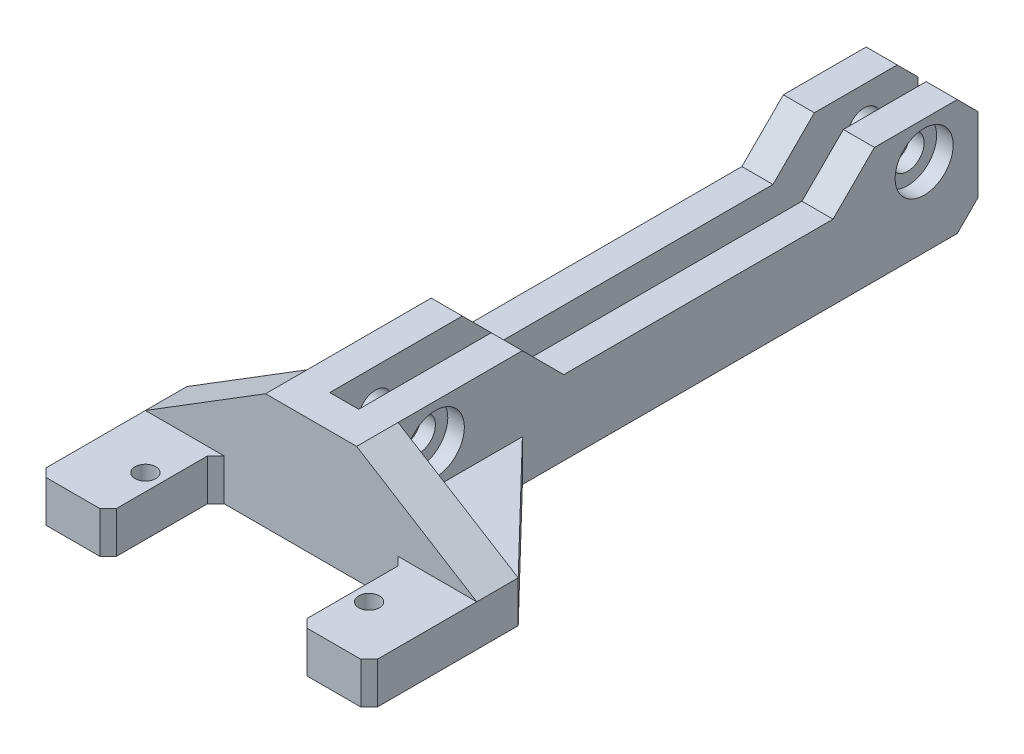
from build123d import *

# Parameters (mm, degrees)
SKETCH1_W           = 11
SKETCH1_H           = 70
SKETCH1_W_2         = 40
SKETCH1_H_2         = 18
BOSS_EXTRUDE1_DEPTH = 5
SKETCH3_W           = 23
SKETCH3_H           = 13
CUT_EXTRUDE2_DEPTH  = 57.868268832
SKETCH4_R           = 1.25
CUT_EXTRUDE3_DEPTH  = 57.868268832
SKETCH5_W           = 11
SKETCH5_H           = 75
BOSS_EXTRUDE2_DEPTH = 9
SKETCH6_W           = 3.5
SKETCH6_H           = 70
CUT_EXTRUDE4_DEPTH  = 59.352377844
SKETCH7_R           = 2
CUT_EXTRUDE5_DEPTH  = 61.458663564
RIB2_REACH          = 80.873
SKETCH8_WALL_W      = 176.81268046
SKETCH8_WALL_H      = 5
RIB4_REACH          = 80.873
SKETCH9_WALL_W      = 176.81268046
SKETCH9_WALL_H      = 5
RIB8_REACH          = 60.352
SKETCH10_WALL_W     = 139.567401732
SKETCH10_WALL_H     = 5
SKETCH14_W          = 42.5
SKETCH14_H          = 5
CUT_EXTRUDE6_DEPTH  = 61.458663564
CHAMFER9_SIZE       = 5
CHAMFER10_SIZE      = 2.5
CHAMFER11_SIZE      = 1
CHAMFER12_SIZE      = 1
SKETCH15_R          = 3.5
CUT_EXTRUDE7_DEPTH  = 2
CHAMFER14_SIZE      = 1


with BuildPart() as part:
    # Sketch1 → Boss-Extrude1 (new body)
    with BuildSketch(Plane(origin=(0, 0, 0), x_dir=(1, 0, 0), z_dir=(0, 1, 0))):
        Rectangle(SKETCH1_W, SKETCH1_H)
        with Locations((0, -44)):
            Rectangle(SKETCH1_W_2, SKETCH1_H_2)
    extrude(amount=BOSS_EXTRUDE1_DEPTH)

    # Sketch3 → Cut-Extrude2 (cut, through all)
    with BuildSketch(Plane(origin=(0, 5, 0), x_dir=(1, 0, 0), z_dir=(0, 1, 0))):
        with Locations((0, -46.5)):
            Rectangle(SKETCH3_W, SKETCH3_H)
    extrude(amount=-CUT_EXTRUDE2_DEPTH, mode=Mode.SUBTRACT)

    # Sketch4 → Cut-Extrude3 (cut, through all)
    with BuildSketch(Plane(origin=(0, 5, 0), x_dir=(1, 0, 0), z_dir=(0, 1, 0))):
        with Locations(Location((-13.5, -46.5, 0), (0, 0, 270))):
            Circle(SKETCH4_R)
        with Locations(Location((13.5, -46.5, 0), (0, 0, 270))):
            Circle(SKETCH4_R)
    extrude(amount=-CUT_EXTRUDE3_DEPTH, mode=Mode.SUBTRACT)

    # Sketch5 → Boss-Extrude2 (add)
    with BuildSketch(Plane(origin=(0, 5, 0), x_dir=(1, 0, 0), z_dir=(0, 1, 0))):
        with Locations((0, -2.5)):
            Rectangle(SKETCH5_W, SKETCH5_H)
    extrude(amount=BOSS_EXTRUDE2_DEPTH)

    # Sketch6 → Cut-Extrude4 (cut, through all)
    with BuildSketch(Plane.XZ):
        Rectangle(SKETCH6_W, SKETCH6_H)
    extrude(amount=-CUT_EXTRUDE4_DEPTH, mode=Mode.SUBTRACT)

    # Sketch7 → Cut-Extrude5 (cut, through all)
    with BuildSketch(Plane.ZY.offset(5.5)):
        with Locations((-28.5, 9.5)):
            Circle(SKETCH7_R)
        with Locations((30.5, 9.5)):
            Circle(SKETCH7_R)
    extrude(amount=-CUT_EXTRUDE5_DEPTH, mode=Mode.SUBTRACT)

    # Sketch8 wall → Rib2 (add, up to next)
    with BuildSketch(Plane(origin=(-12.75, 9.5, 40), x_dir=(-0.849640166198, -0.527362861778, 0), z_dir=(0.527362861778, -0.849640166198, 0)), mode=Mode.PRIVATE) as rib2_sk1:
        with Locations((0, 2.5)):
            Rectangle(SKETCH8_WALL_W, SKETCH8_WALL_H)
    rib2_tool1 = extrude(rib2_sk1.sketch, amount=RIB2_REACH, mode=Mode.PRIVATE) - part.part
    add(rib2_tool1.solids().sort_by_distance((-12.75, 9.5, 40))[0])

    # Sketch9 wall → Rib4 (add, up to next)
    with BuildSketch(Plane(origin=(12.75, 9.5, 40), x_dir=(0.849640166198, -0.527362861778, 0), z_dir=(0.527362861778, 0.849640166198, 0)), mode=Mode.PRIVATE) as rib4_sk1:
        with Locations((0, 2.5)):
            Rectangle(SKETCH9_WALL_W, SKETCH9_WALL_H)
    rib4_tool1 = extrude(rib4_sk1.sketch, amount=-RIB4_REACH, mode=Mode.PRIVATE) - part.part
    add(rib4_tool1.solids().sort_by_distance((12.75, 9.5, 40))[0])

    # Sketch10 wall → Rib8 (add, up to next)
    with BuildSketch(Plane(origin=(-12.75, 0, 27.5), x_dir=(0.695022096847, 0, -0.718988376049), z_dir=(0.718988376049, 0, 0.695022096847)), mode=Mode.PRIVATE) as rib8_sk1:
        with Locations((0, 2.5)):
            Rectangle(SKETCH10_WALL_W, SKETCH10_WALL_H)
    rib8_tool1 = extrude(rib8_sk1.sketch, amount=RIB8_REACH, mode=Mode.PRIVATE) - part.part
    rib8 = rib8_tool1.solids().sort_by_distance((-12.75, 0, 27.5))[0]
    add(rib8)

    # Mirror1: Rib8 across plane
    add(rib8.mirror(Plane(origin=(0, 0, 0), x_dir=(0, 0, 1), z_dir=(1, 0, 0))))

    # Sketch14 → Cut-Extrude6 (cut, through all)
    with BuildSketch(Plane(origin=(5.5, 0, 0), x_dir=(0, 0, -1), z_dir=(1, 0, 0))):
        with Locations((1.25, 11.5)):
            Rectangle(SKETCH14_W, SKETCH14_H)
    extrude(amount=-CUT_EXTRUDE6_DEPTH, mode=Mode.SUBTRACT)

    # Chamfer9
    chamfer9_edges = [part.edges().sort_by_distance(p)[0] for p in [
        (3.625, 9, -22.5),
        (-3.625, 9, -22.5),
        (3.625, 9, 20),
        (-3.625, 9, 20),
    ]]
    chamfer(chamfer9_edges, length=CHAMFER9_SIZE - 0.0001)  # a hair under: the kernel refuses the full size

    # Chamfer10
    chamfer10_edges = [part.edges().sort_by_distance(p)[0] for p in [
        (-3.625, 0, -35),
        (3.625, 14, -35),
        (-3.625, 14, -35),
        (3.625, 0, -35),
    ]]
    chamfer(chamfer10_edges, length=CHAMFER10_SIZE)

    # Chamfer11
    chamfer11_edges = [part.edges().sort_by_distance(p)[0] for p in [
        (-11.5, 2.5, 53),
        (11.5, 2.5, 53),
        (-20, 2.5, 53),
        (20, 2.5, 53),
    ]]
    chamfer(chamfer11_edges, length=CHAMFER11_SIZE)

    # Chamfer12
    chamfer12_edges = [part.edges().sort_by_distance(p)[0] for p in [
        (-11.5, 2.5, 40),
        (11.5, 2.5, 40),
    ]]
    chamfer(chamfer12_edges, length=CHAMFER12_SIZE)

    # Sketch15 → Cut-Extrude7 (cut)
    with BuildSketch(Plane(origin=(5.5, 0, 0), x_dir=(0, 0, -1), z_dir=(1, 0, 0))):
        with Locations((28.5, 9.5)):
            Circle(SKETCH15_R)
        with Locations((-30.5, 9.5)):
            Circle(SKETCH15_R)
    extrude(amount=-CUT_EXTRUDE7_DEPTH, mode=Mode.SUBTRACT)

    # Chamfer14
    chamfer14_edges = [part.edges().sort_by_distance(p)[0] for p in [
        (0, 14, 35),
        (0, 0, 35),
    ]]
    chamfer(chamfer14_edges, length=CHAMFER14_SIZE)


solid = part.part
